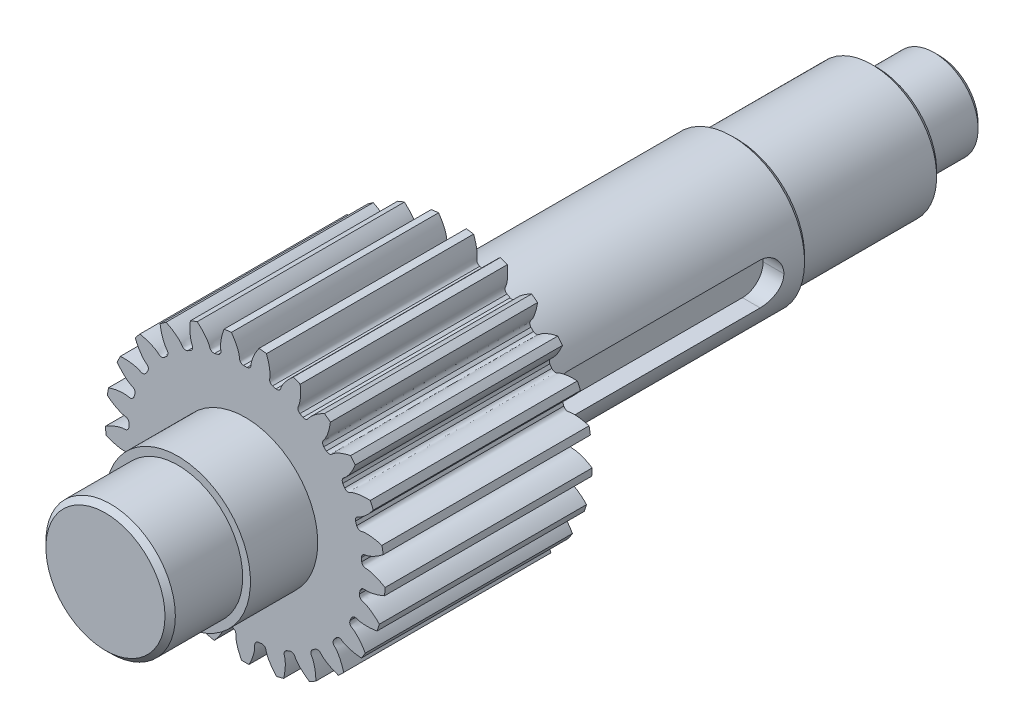
from build123d import *

# Parameters (mm, degrees)
SKETCH_1_R               = 27
EXTRUDE_1_DEPTH          = 40
CUT_EXTRUDE_1_DEPTH      = 56.299186251
PATTERN_CIRCULAR_1_COUNT = 25
SKETCH_4_R               = 14
EXTRUDE_2_DEPTH          = 13
SKETCH_5_R               = 12.5
EXTRUDE_3_DEPTH          = 14
CHAMFER_2_SIZE           = 1
EXTRUDE_START            = 55
SKETCH_6_R               = 14
EXTRUDE_4_DEPTH          = 55
EXTRUDE_START_2          = 27
SKETCH_7_R               = 12.5
EXTRUDE_5_DEPTH          = 27
SKETCH_8_R               = 8.5
EXTRUDE_6_DEPTH          = 12
CUT_EXTRUDE_2_DEPTH      = 4
CUT_EXTRUDE_2_DEPTH_BACK = 4
SKETCH_9_W               = 4
SKETCH_9_H               = 45
FILLET_1_R               = 4
CHAMFER_3_SIZE           = 1


with BuildPart() as part:
    # 草图1 → 凸台-拉伸1 (new body)
    with BuildSketch(Plane.XY):
        Circle(SKETCH_1_R)
    extrude(amount=EXTRUDE_1_DEPTH)

    # 草图2 → 切除-拉伸1 (cut, through all)
    with BuildSketch(Plane.XY):
        with BuildLine():
            ThreePointArc((0.344116975, 22.497368368), (0, 22.5), (-0.344116975, 22.497368368))
            add(Edge.make_bspline(
                [(-0.344116975, 22.497368368), (-1.146679625, 22.670162324), (-1.071015271, 23.15452279), (-1.148390771, 23.63610551), (-1.159242542, 23.696216884), (-1.173152862, 23.765311048), (-1.190471038, 23.843288899), (-1.21156157, 23.930037163), (-1.236779858, 24.025432794), (-1.266479692, 24.129341666), (-1.301010489, 24.241619099), (-1.340717785, 24.362109831), (-1.385942711, 24.490648157), (-1.437021786, 24.627058036), (-1.494286621, 24.771153209), (-1.558063652, 24.922737333), (-1.628673863, 25.081604108), (-1.706432524, 25.247537423), (-1.791648926, 25.420311498), (-1.884626123, 25.599691044), (-1.98566067, 25.785431419), (-2.095042378, 25.977278799), (-2.213054062, 26.174970347), (-2.339971299, 26.378234395), (-2.476062186, 26.586790632), (-2.621587107, 26.800350289), (-2.776798506, 27.018616344), (-2.941940654, 27.241283721), (-3.117249438, 27.4680395), (-3.302952138, 27.698563134), (-3.499267222, 27.932526665), (-3.70640414, 28.169594952), (-3.924563124, 28.409425902), (-4.153934996, 28.651670706), (-4.39470098, 28.895974077), (-4.647032523, 29.141974498), (-4.911091109, 29.389304472), (-5.187028119, 29.637590775), (-5.474984573, 29.886454718), (-5.879947889, 30.222532548), (-6.194933099, 30.468186305), (-6.410542951, 30.629668343)],
                knots=[0, 0, 0, 0, 0.130741207, 0.13574479, 0.141658115, 0.148481183, 0.156213993, 0.164856545, 0.174408839, 0.184870876, 0.196242655, 0.208524177, 0.221715441, 0.235816447, 0.250827195, 0.266747686, 0.283577919, 0.301317894, 0.319967612, 0.339527072, 0.359996274, 0.381375219, 0.403663906, 0.426862335, 0.450970507, 0.475988421, 0.501916077, 0.528753476, 0.556500617, 0.5851575, 0.614724126, 0.645200493, 0.676586604, 0.708882456, 0.742088051, 0.776203388, 0.811228468, 0.847163289, 0.884007854, 0.92176216, 1, 1, 1, 1], degree=3))
            ThreePointArc((-6.410542951, 30.629668343), (0, 31.293316279), (6.410542951, 30.629668343))
            add(Edge.make_bspline(
                [(0.344116975, 22.497368368), (1.146679625, 22.670162324), (1.071015271, 23.15452279), (1.148390771, 23.63610551), (1.159242542, 23.696216884), (1.173152862, 23.765311048), (1.190471038, 23.843288899), (1.21156157, 23.930037163), (1.236779858, 24.025432794), (1.266479692, 24.129341666), (1.301010489, 24.241619099), (1.340717785, 24.362109831), (1.385942711, 24.490648157), (1.437021786, 24.627058036), (1.494286621, 24.771153209), (1.558063652, 24.922737333), (1.628673863, 25.081604108), (1.706432524, 25.247537423), (1.791648926, 25.420311498), (1.884626123, 25.599691044), (1.98566067, 25.785431419), (2.095042378, 25.977278799), (2.213054062, 26.174970347), (2.339971299, 26.378234395), (2.476062186, 26.586790632), (2.621587107, 26.800350289), (2.776798506, 27.018616344), (2.941940654, 27.241283721), (3.117249438, 27.4680395), (3.302952138, 27.698563134), (3.499267222, 27.932526665), (3.70640414, 28.169594952), (3.924563124, 28.409425902), (4.153934996, 28.651670706), (4.39470098, 28.895974077), (4.647032523, 29.141974498), (4.911091109, 29.389304472), (5.187028119, 29.637590775), (5.474984573, 29.886454718), (5.879947889, 30.222532548), (6.194933099, 30.468186305), (6.410542951, 30.629668343)],
                knots=[0, 0, 0, 0, 0.130741207, 0.13574479, 0.141658115, 0.148481183, 0.156213993, 0.164856545, 0.174408839, 0.184870876, 0.196242655, 0.208524177, 0.221715441, 0.235816447, 0.250827195, 0.266747686, 0.283577919, 0.301317894, 0.319967612, 0.339527072, 0.359996274, 0.381375219, 0.403663906, 0.426862335, 0.450970507, 0.475988421, 0.501916077, 0.528753476, 0.556500617, 0.5851575, 0.614724126, 0.645200493, 0.676586604, 0.708882456, 0.742088051, 0.776203388, 0.811228468, 0.847163289, 0.884007854, 0.92176216, 1, 1, 1, 1], degree=3))
        make_face()
    cut_extrude_1 = extrude(amount=CUT_EXTRUDE_1_DEPTH, mode=Mode.SUBTRACT)

    # 阵列(圆周)1: 切除-拉伸1 ×25 about axis
    pattern_circular_1_axis = Axis((0, 0, 40), (0, 0, -1))
    for i in range(1, PATTERN_CIRCULAR_1_COUNT):
        add(cut_extrude_1.rotate(pattern_circular_1_axis, i * 360 / PATTERN_CIRCULAR_1_COUNT), mode=Mode.SUBTRACT)

    # 草图4 → 凸台-拉伸2 (add)
    with BuildSketch(Plane.XY.offset(40)):
        with Locations(Location((0, 0, 0), (0, 0, 180))):
            Circle(SKETCH_4_R)
    extrude(amount=EXTRUDE_2_DEPTH)

    # 草图5 → 凸台-拉伸3 (add)
    with BuildSketch(Plane.XY.offset(53)):
        Circle(SKETCH_5_R)
    extrude(amount=EXTRUDE_3_DEPTH)

    # 倒角2
    chamfer_2_edges = [part.edges().sort_by_distance(p)[0] for p in [
        (-12.5, 0, 67),
    ]]
    chamfer(chamfer_2_edges, length=CHAMFER_2_SIZE)

    # 草图6 → 凸台-拉伸4 (add)
    with BuildSketch(Plane(origin=(0, 0, 0), x_dir=(-1, 0, 0), z_dir=(0, 0, -1)).offset(EXTRUDE_START)):
        Circle(SKETCH_6_R)
    extrude(amount=-EXTRUDE_4_DEPTH)

    # 草图7 → 凸台-拉伸5 (add)
    with BuildSketch(Plane(origin=(0, 0, -55), x_dir=(-1, 0, 0), z_dir=(0, 0, -1)).offset(EXTRUDE_START_2)):
        with Locations(Location((0, 0, 0), (0, 0, 180))):
            Circle(SKETCH_7_R)
    extrude(amount=-EXTRUDE_5_DEPTH)

    # 草图8 → 凸台-拉伸6 (add)
    with BuildSketch(Plane(origin=(0, 0, -82), x_dir=(-1, 0, 0), z_dir=(0, 0, -1))):
        Circle(SKETCH_8_R)
    extrude(amount=EXTRUDE_6_DEPTH)

    # 草图9 → 切除-拉伸2 (cut, two sides: drawn at the far end of the back side and taken through both)
    with BuildSketch(Plane(origin=(0, 0, 0), x_dir=(1, 0, 0), z_dir=(0, 1, 0)).offset(-CUT_EXTRUDE_2_DEPTH_BACK)):
        with Locations((12, 27.5)):
            Rectangle(SKETCH_9_W, SKETCH_9_H)
    extrude(amount=CUT_EXTRUDE_2_DEPTH + CUT_EXTRUDE_2_DEPTH_BACK, mode=Mode.SUBTRACT)

    # 圆角1
    fillet_1_edges = [part.edges().sort_by_distance(p)[0] for p in [
        (11.708203932, 4, -50),
        (11.708203932, -4, -50),
        (11.708203932, 4, -5),
        (11.708203932, -4, -5),
    ]]
    fillet(fillet_1_edges, radius=FILLET_1_R - 0.0001)  # a hair under: the kernel refuses the full size

    # 倒角3
    chamfer_3_edges = [part.edges().sort_by_distance(p)[0] for p in [
        (14, 0, -55),
        (-12.5, 0, -82),
        (8.5, 0, -94),
    ]]
    chamfer(chamfer_3_edges, length=CHAMFER_3_SIZE)


solid = part.part
